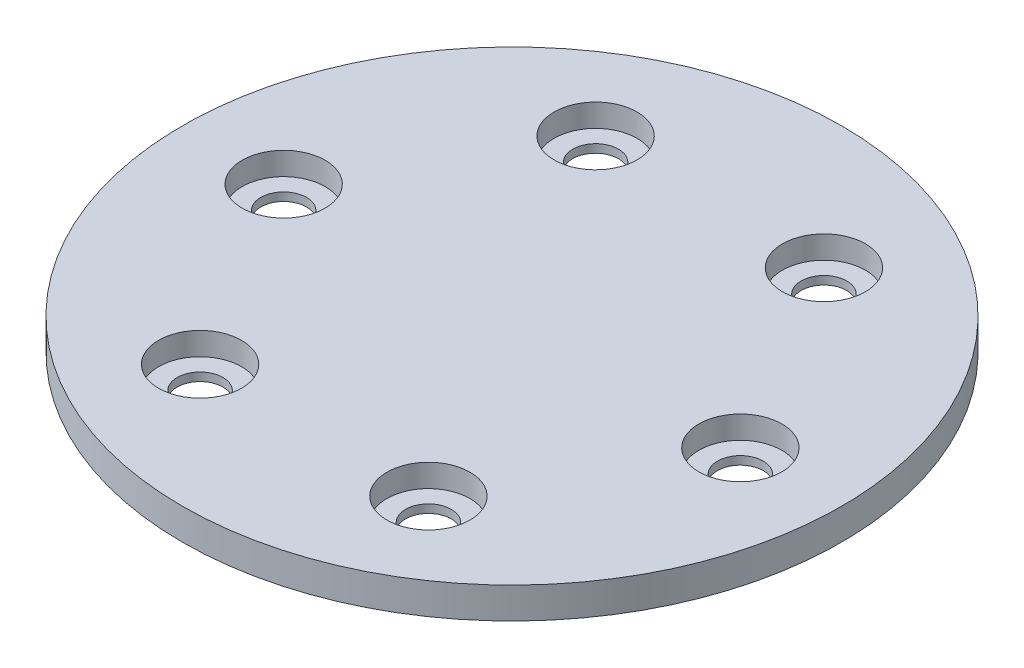
from build123d import *

# Parameters (mm, degrees)
SKETCH1_R           = 15.875
BOSS_EXTRUDE1_DEPTH = 1.5
CIRPATTERN1_COUNT   = 6


with BuildPart() as part:
    # Sketch1 → Boss-Extrude1 (new body)
    with BuildSketch(Plane(origin=(0, 0, 0), x_dir=(1, 0, 0), z_dir=(0, 1, 0))):
        Circle(SKETCH1_R)
    extrude(amount=BOSS_EXTRUDE1_DEPTH)

    # Sketch7 → CBORE for M5 Hex Head Bolt1 (revolve, cut)
    with BuildSketch(Plane(origin=(11, 1.5, 0), x_dir=(0, 0, 1), z_dir=(1, 0, 0))):
        Polygon((0, 0), (0, 5.660946681), (1.1, 5), (1.1, 1.1), (2, 1.1), (2, 0), align=None)
    cbore_for_m5_hex_head_bolt1 = revolve(axis=Axis((11, 7.85, 0), (0, -1, 0)), mode=Mode.SUBTRACT)

    # CirPattern1: CBORE for M5 Hex Head Bolt1 ×6 about axis
    cirpattern1_axis = Axis((0, 1.5, 0), (0, 1, 0))
    for i in range(1, CIRPATTERN1_COUNT):
        add(cbore_for_m5_hex_head_bolt1.rotate(cirpattern1_axis, i * 360 / CIRPATTERN1_COUNT), mode=Mode.SUBTRACT)


solid = part.part
